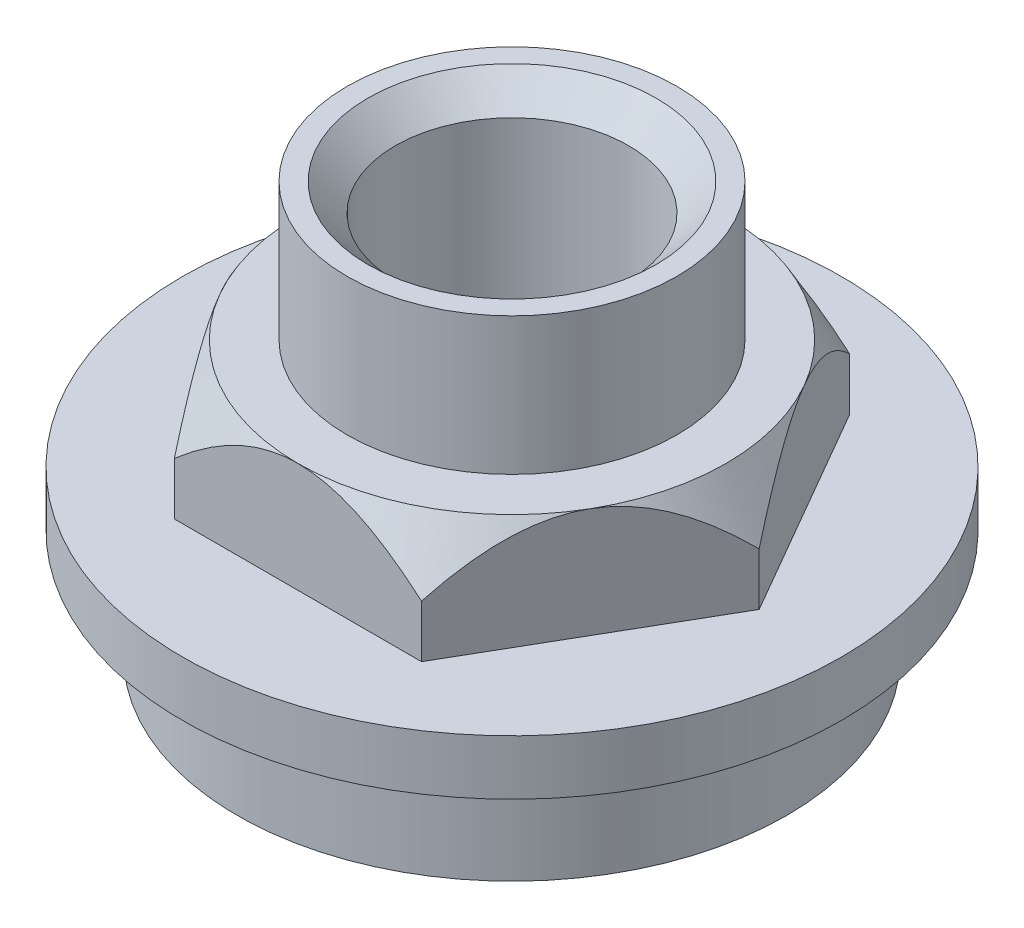
from build123d import *

# Parameters (mm, degrees)
BOSS_EXTRUDE1_DEPTH = 4
SKETCH3_R           = 4.25
CUT_EXTRUDE1_DEPTH  = 10
CUT_EXTRUDE2_START  = -10
SKETCH4_R           = 4.25
CUT_EXTRUDE2_DEPTH  = 10
SKETCH5_OUTSIDE_W   = 33.422
SKETCH5_OUTSIDE_H   = 33.422
SKETCH5_OUTSIDE_R   = 8.25
CUT_EXTRUDE3_DEPTH  = 0.5
CHAMFER1_SIZE       = 1


# Read off the part's stored shape, not the designer's step: Cut-Extrude4
with BuildPart() as part:
    # Sketch1 → Revolve1 (revolve)
    with BuildSketch(Plane.XY, mode=Mode.PRIVATE) as revolve1_sk:
        Polygon((0, 0), (10, 0), (10, 4), (12, 4), (12, 6), (6, 6), (6, 15), (0, 15), align=None)
    revolve(revolve1_sk.sketch.rotate(Axis((0, 15, 0), (0, -1, 0)), 180), axis=Axis((0, 15, 0), (0, -1, 0)))

    # Sketch2 → Boss-Extrude1 (add)
    with BuildSketch(Plane(origin=(0, 6, 0), x_dir=(1, 0, 0), z_dir=(0, 1, 0))):
        Polygon((9, 0), (4.5, 7.794228634), (-4.5, 7.794228634), (-9, 0), (-4.5, -7.794228634), (4.5, -7.794228634), align=None)
    extrude(amount=BOSS_EXTRUDE1_DEPTH)

    # Sketch3 → Cut-Extrude1 (cut)
    with BuildSketch(Plane(origin=(0, 15, 0), x_dir=(1, 0, 0), z_dir=(0, 1, 0))):
        with Locations(Location((0, 0, 0), (0, 0, 180))):
            Circle(SKETCH3_R)
    extrude(amount=-CUT_EXTRUDE1_DEPTH, mode=Mode.SUBTRACT)

    # Sketch4 → Cut-Extrude2 (cut)
    with BuildSketch(Plane.XZ.offset(CUT_EXTRUDE2_START)):
        with Locations(Location((0, 0, 0), (0, 0, 180))):
            Circle(SKETCH4_R)
    extrude(amount=CUT_EXTRUDE2_DEPTH, mode=Mode.SUBTRACT)

    # Sketch5 outside → Cut-Extrude3 (cut)
    with BuildSketch(Plane.XZ.offset(-4)):
        Rectangle(SKETCH5_OUTSIDE_W, SKETCH5_OUTSIDE_H)
        Circle(SKETCH5_OUTSIDE_R, mode=Mode.SUBTRACT)
    extrude(amount=CUT_EXTRUDE3_DEPTH, mode=Mode.SUBTRACT)

    # Cut-Extrude4 outline → Cut-Extrude4 (revolve, cut)
    with BuildSketch(Plane.XY):
        Polygon((9.000000004, 10.000001017), (7.794228286, 10.000001017), (9.000000004, 7.911542725), align=None)
    revolve(axis=Axis((0, 0, 0), (0, 1, 0)), mode=Mode.SUBTRACT)

    # Chamfer1
    chamfer1_edges = [part.edges().sort_by_distance(p)[0] for p in [
        (4.25, 15, 0),
    ]]
    chamfer(chamfer1_edges, length=CHAMFER1_SIZE)


solid = part.part
